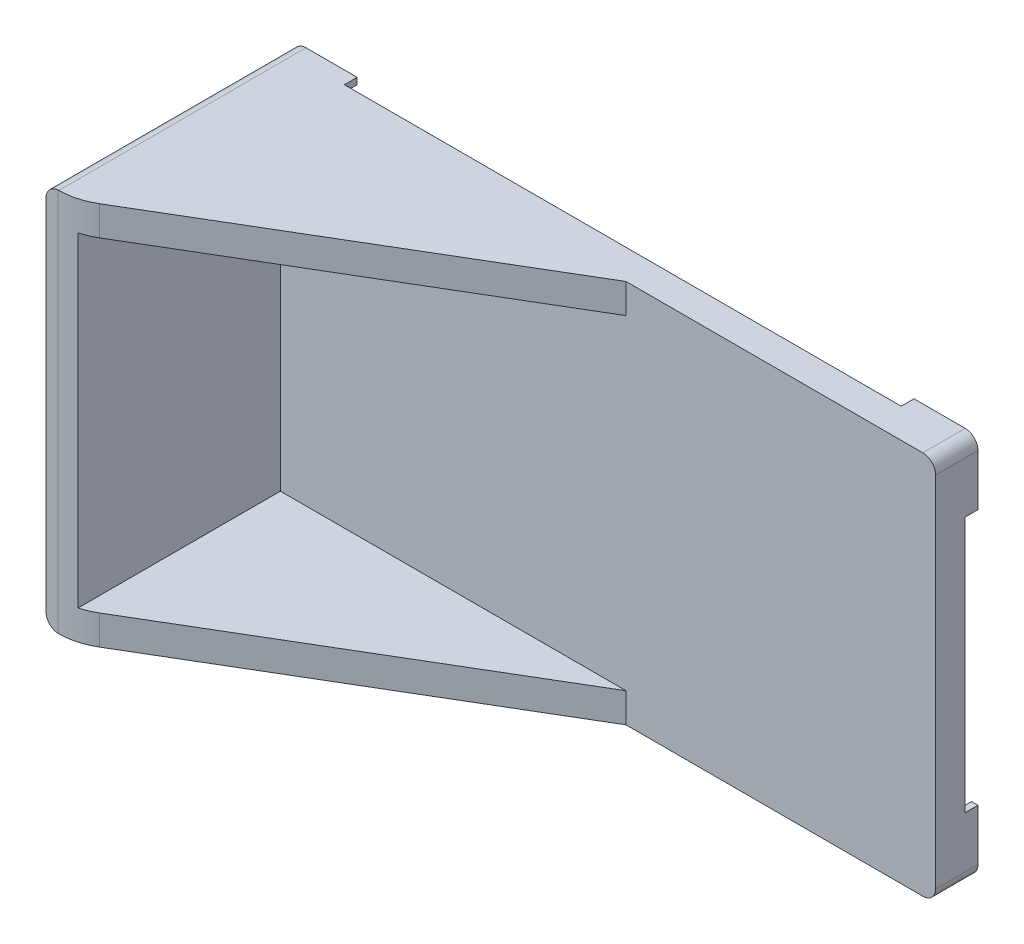
from build123d import *

# Parameters (mm, degrees)
SKETCH1_W            = 53.5
SKETCH1_H            = 30
BOSS_EXTRUDE1_DEPTH  = 2.3114
SKETCH2_W            = 2.3114
SKETCH2_H            = 30
BOSS_EXTRUDE2_DEPTH  = 16
BOSS_EXTRUDE3_DEPTH  = 2.3114
FILLET1_R            = 1
FILLET2_START        = -16
FILLET2_DEPTH        = 32
BOSS_EXTRUDE5_DEPTH  = 1
MIRROR3_COPY_1_DEPTH = 1


with BuildPart() as part:
    # Sketch1 → Boss-Extrude1 (new body)
    with BuildSketch(Plane.XY):
        Rectangle(SKETCH1_W, SKETCH1_H)
    extrude(amount=BOSS_EXTRUDE1_DEPTH)

    # Sketch2 → Boss-Extrude2 (add)
    with BuildSketch(Plane.XY.offset(2.3114)):
        with Locations((-25.5943, 0)):
            Rectangle(SKETCH2_W, SKETCH2_H)
    extrude(amount=BOSS_EXTRUDE2_DEPTH)

    # Sketch3 → Boss-Extrude3 (add)
    with BuildSketch(Plane.XZ.offset(15)):
        Polygon((-24.4386, 18.3114), (2.5614, 2.3114), (-24.4386, 2.3114), align=None)
    boss_extrude3 = extrude(amount=-BOSS_EXTRUDE3_DEPTH)

    # Mirror1: Boss-Extrude3 across plane
    add(boss_extrude3.mirror(Plane.ZX))

    # Fillet1
    fillet1_edges = [part.edges().sort_by_distance(p)[0] for p in [
        (26.75, 15, 1.1557),
        (26.75, -15, 1.1557),
        (-26.75, 15, 9.1557),
        (-26.75, -15, 9.1557),
    ]]
    fillet(fillet1_edges, radius=FILLET1_R)

    # Fillet2: read off the stored shape, not the designer's step
    # Fillet2 outline → Fillet2 (cut)
    with BuildSketch(Plane(origin=(0, 0, 0), x_dir=(1, 0, 0), z_dir=(0, 1, 0)).offset(FILLET2_START)):
        with BuildLine():
            Line((-24.4386, -18.3114), (-23.259809815, -17.612857668))
            ThreePointArc((-23.259809815, -17.612857668), (-24.487324196, -18.133603249), (-25.808821767, -18.3114))
            Line((-25.808821767, -18.3114), (-24.4386, -18.3114))
        make_face()
    extrude(amount=FILLET2_DEPTH, mode=Mode.SUBTRACT)

    # Sketch7 → Boss-Extrude5 (add)
    with BuildSketch(Plane(origin=(0, 0, 0), x_dir=(-1, 0, 0), z_dir=(0, 0, -1))):
        with BuildLine():
            Line((-25.75, 15), (-21.75, 15))
            Line((-21.75, 15), (-21.75, 14.5))
            Line((-21.75, 14.5), (-25.75, 14.5))
            ThreePointArc((-25.75, 14.5), (-26.103553391, 14.353553391), (-26.25, 14))
            Line((-26.25, 14), (-26.25, 10))
            Line((-26.25, 10), (-26.75, 10))
            Line((-26.75, 10), (-26.75, 14))
            ThreePointArc((-26.75, 14), (-26.457106781, 14.707106781), (-25.75, 15))
        make_face()
    boss_extrude5 = extrude(amount=BOSS_EXTRUDE5_DEPTH)

    # Mirror2: Boss-Extrude5 across plane
    add(boss_extrude5.mirror(Plane.ZX))

    # Mirror3: Boss-Extrude5 across plane
    add(boss_extrude5.mirror(Plane(origin=(0, 0, 0), x_dir=(0, 0, 1), z_dir=(1, 0, 0))))

    # Mirror3 copy 1 sketch → Mirror3 copy 1 (add)
    with BuildSketch(Plane(origin=(0, 0, 0), x_dir=(1, 0, 0), z_dir=(0, 0, -1))):
        with BuildLine():
            Line((-25.75, 15), (-21.75, 15))
            Line((-21.75, 15), (-21.75, 14.5))
            Line((-21.75, 14.5), (-25.75, 14.5))
            ThreePointArc((-25.75, 14.5), (-26.103553391, 14.353553391), (-26.25, 14))
            Line((-26.25, 14), (-26.25, 10))
            Line((-26.25, 10), (-26.75, 10))
            Line((-26.75, 10), (-26.75, 14))
            ThreePointArc((-26.75, 14), (-26.457106781, 14.707106781), (-25.75, 15))
        make_face()
    extrude(amount=MIRROR3_COPY_1_DEPTH)


solid = part.part
